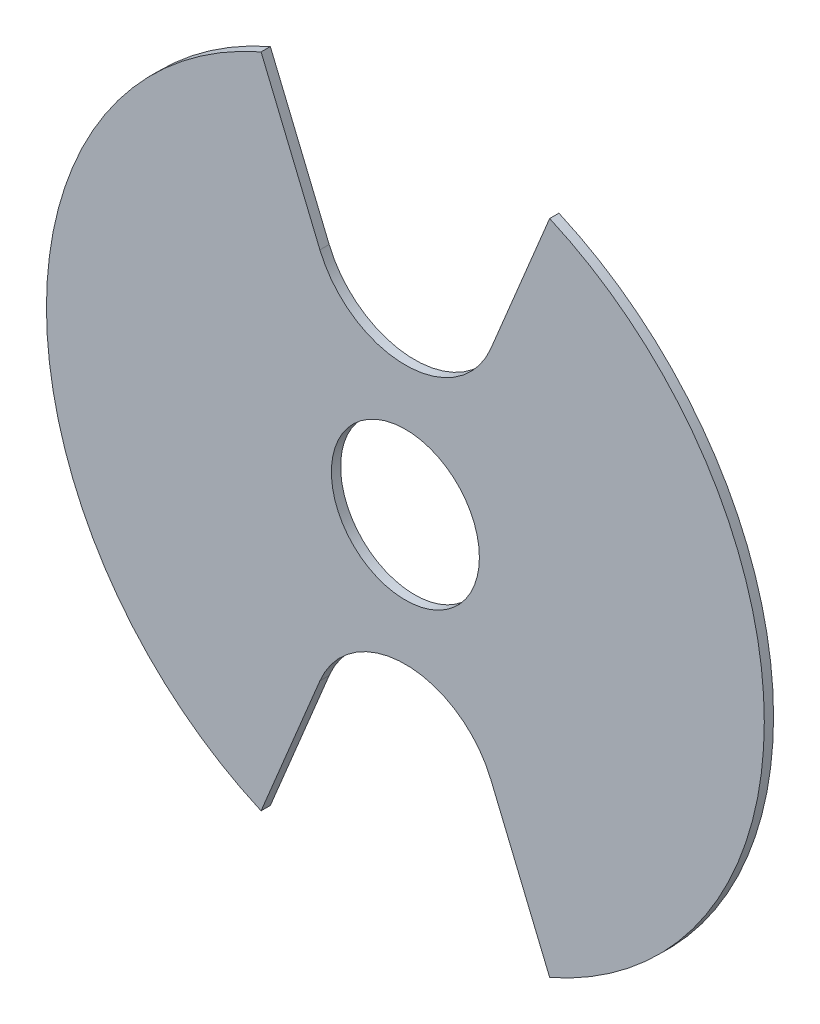
from build123d import *

# Parameters (mm, degrees)
ESQUISSE1_R             = 97
ESQUISSE1_R_2           = 20
MAIN_DEPTH              = 2.5
ENL_V_MAT_EXTRU_1_DEPTH = 138.201494161


with BuildPart() as part:
    # Esquisse1 → Main (new body)
    with BuildSketch(Plane.XY):
        Circle(ESQUISSE1_R)
        Circle(ESQUISSE1_R_2, mode=Mode.SUBTRACT)
    extrude(amount=MAIN_DEPTH)

    # Esquisse2 → Enlèv. mat.-Extru.1 (cut, symmetric)
    with BuildSketch(Plane.XY.offset(2.5)):
        with BuildLine():
            Line((219.060870494, 523.531576288), (38.995875853, 88.816224117))
            Line((38.995875853, 88.816224117), (23.096988313, 50.432914191))
            ThreePointArc((23.096988313, 50.432914191), (0, 35), (-23.096988313, 50.432914191))
            Line((-23.096988313, 50.432914191), (-38.995875853, 88.816224117))
            Line((-38.995875853, 88.816224117), (-219.060870494, 523.531576288))
            Line((-219.060870494, 523.531576288), (-219.060870494, 1464.596589361))
            Line((-219.060870494, 1464.596589361), (219.060870494, 1464.596589361))
            Line((219.060870494, 1464.596589361), (219.060870494, 523.531576288))
        make_face()
    enl_v_mat_extru_1 = extrude(amount=ENL_V_MAT_EXTRU_1_DEPTH, both=True, mode=Mode.SUBTRACT)

    # Symétrie1: Enlèv. mat.-Extru.1 across plane
    add(enl_v_mat_extru_1.mirror(Plane.ZX), mode=Mode.SUBTRACT)


solid = part.part
